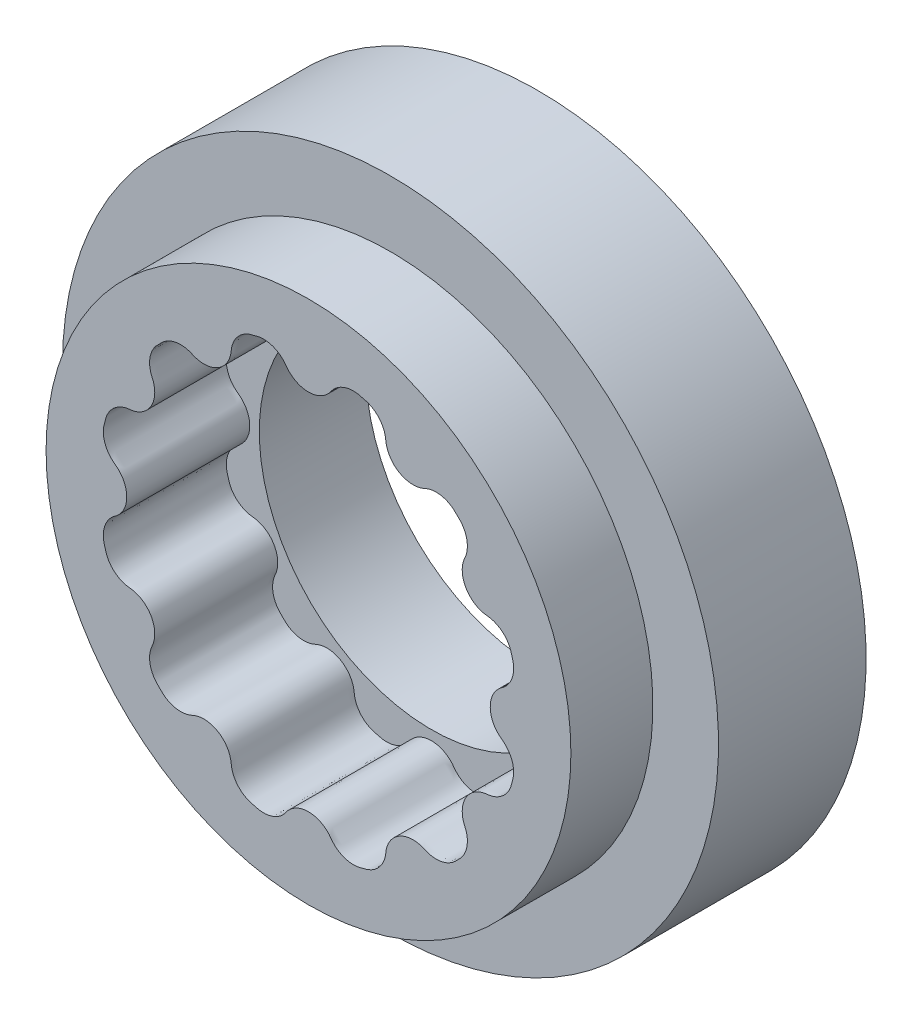
from build123d import *

# Parameters (mm, degrees)
SKETCH1_R           = 32
BOSS_EXTRUDE1_DEPTH = 15
SKETCH3_R           = 40
SKETCH3_R_2         = 30
BOSS_EXTRUDE3_DEPTH = 5
BOSS_EXTRUDE4_START = 13
SKETCH4_R           = 40
SKETCH4_R_2         = 21
BOSS_EXTRUDE4_DEPTH = 13
SKETCH5_R           = 1.5
CUT_EXTRUDE1_DEPTH  = 15
SKETCH6_R           = 2.5
CUT_EXTRUDE2_DEPTH  = 3


with BuildPart() as part:
    # Sketch1 → Boss-Extrude1 (new body)
    with BuildSketch(Plane.XY):
        Circle(SKETCH1_R)
        with BuildLine():
            add(Edge.make_bspline(
                [(7.008727405, -24.725851657), (8.387650315, -24.334985655), (9.300444766, -23.229992029), (9.423952389, -21.802073792), (9.424010864, -21.801397737), (9.424127402, -21.800045592), (9.424300875, -21.79801726), (9.42441742, -21.796665116), (9.424475899, -21.795989061), (9.64427829, -19.254928914), (11.853118443, -17.979654457), (14.163642278, -19.059830077), (14.164256998, -19.06011746), (14.165486262, -19.060692601), (14.167329586, -19.061556535), (14.168558847, -19.062131682), (14.169173565, -19.062419069), (15.452230516, -19.662259733), (16.850366203, -19.435851779), (17.878544188, -18.46173988), (17.885306871, -18.455332808), (17.898778593, -18.442462044), (17.918818206, -18.422980608), (17.93216718, -18.409982809), (17.938838132, -18.403480282), (18.095694749, -18.250583904), (18.250583904, -18.095694749), (18.403480282, -17.938838132), (18.409982809, -17.93216718), (18.422980608, -17.918818206), (18.442462044, -17.898778593), (18.455332808, -17.885306871), (18.46173988, -17.878544188), (19.435851779, -16.850366203), (19.662259733, -15.452230516), (19.062419069, -14.169173565), (19.062131682, -14.168558847), (19.061556535, -14.167329586), (19.060692601, -14.165486262), (19.06011746, -14.164256998), (19.059830077, -14.163642278), (17.979654457, -11.853118443), (19.254928914, -9.64427829), (21.795989061, -9.424475899), (21.796665116, -9.42441742), (21.79801726, -9.424300875), (21.800045592, -9.424127402), (21.801397737, -9.424010864), (21.802073792, -9.423952389), (23.213154038, -9.301901166), (24.310771085, -8.406758284), (24.71414339, -7.04906364), (24.716796509, -7.040133612), (24.72202798, -7.022251341), (24.729642076, -6.995360117), (24.734703727, -6.977429206), (24.737229677, -6.968462376), (24.796623304, -6.75762192), (24.85331667, -6.5460394), (24.907300508, -6.333749395), (24.909596386, -6.324720918), (24.914178322, -6.306661468), (24.921029935, -6.279565937), (24.925440483, -6.261463701), (24.927607828, -6.25240351), (25.257124487, -4.874919305), (24.754131682, -3.550894306), (23.593125953, -2.739654723), (23.59256971, -2.739266055), (23.591456988, -2.738489058), (23.589787137, -2.73732466), (23.588674418, -2.736547656), (23.588118177, -2.736158985), (21.497396733, -1.275274457), (21.497396733, 1.275274457), (23.588118177, 2.736158985), (23.588674418, 2.736547656), (23.589787137, 2.73732466), (23.591456988, 2.738489058), (23.59256971, 2.739266055), (23.593125953, 2.739654723), (24.754131682, 3.550894306), (25.257124487, 4.874919305), (24.927607828, 6.25240351), (24.925440483, 6.261463701), (24.921029935, 6.279565937), (24.914178322, 6.306661468), (24.909596386, 6.324720918), (24.907300508, 6.333749395), (24.85331667, 6.5460394), (24.796623304, 6.75762192), (24.737229677, 6.968462376), (24.734703727, 6.977429206), (24.729642076, 6.995360117), (24.72202798, 7.022251341), (24.716796509, 7.040133612), (24.71414339, 7.04906364), (24.310771085, 8.406758284), (23.213154038, 9.301901166), (21.802073792, 9.423952389), (21.801397737, 9.424010864), (21.800045592, 9.424127402), (21.79801726, 9.424300875), (21.796665116, 9.42441742), (21.795989061, 9.424475899), (19.254928914, 9.64427829), (17.979654457, 11.853118443), (19.059830077, 14.163642278), (19.06011746, 14.164256998), (19.060692601, 14.165486262), (19.061556535, 14.167329586), (19.062131682, 14.168558847), (19.062419069, 14.169173565), (19.662259733, 15.452230516), (19.435851779, 16.850366203), (18.46173988, 17.878544188), (18.455332808, 17.885306871), (18.442462044, 17.898778593), (18.422980608, 17.918818206), (18.409982809, 17.93216718), (18.403480282, 17.938838132), (18.250583904, 18.095694749), (18.095694749, 18.250583904), (17.938838132, 18.403480282), (17.93216718, 18.409982809), (17.918818206, 18.422980608), (17.898778593, 18.442462044), (17.885306871, 18.455332808), (17.878544188, 18.46173988), (16.850366203, 19.435851779), (15.452230516, 19.662259733), (14.169173565, 19.062419069), (14.168558847, 19.062131682), (14.167329586, 19.061556535), (14.165486262, 19.060692601), (14.164256998, 19.06011746), (14.163642278, 19.059830077), (11.853118443, 17.979654457), (9.64427829, 19.254928914), (9.424475899, 21.795989061), (9.42441742, 21.796665116), (9.424300875, 21.79801726), (9.424127402, 21.800045592), (9.424010864, 21.801397737), (9.423952389, 21.802073792), (9.301901166, 23.213154038), (8.406758284, 24.310771085), (7.04906364, 24.71414339), (7.040133612, 24.716796509), (7.022251341, 24.72202798), (6.995360117, 24.729642076), (6.977429206, 24.734703727), (6.968462376, 24.737229677), (6.75762192, 24.796623304), (6.5460394, 24.85331667), (6.333749395, 24.907300508), (6.324720918, 24.909596386), (6.306661468, 24.914178322), (6.279565937, 24.921029935), (6.261463701, 24.925440483), (6.25240351, 24.927607828), (4.874919305, 25.257124487), (3.550894306, 24.754131682), (2.739654723, 23.593125953), (2.739266055, 23.59256971), (2.738489058, 23.591456988), (2.73732466, 23.589787137), (2.736547656, 23.588674418), (2.736158985, 23.588118177), (1.275274457, 21.497396733), (-1.275274457, 21.497396733), (-2.736158985, 23.588118177), (-2.736547656, 23.588674418), (-2.73732466, 23.589787137), (-2.738489058, 23.591456988), (-2.739266055, 23.59256971), (-2.739654723, 23.593125953), (-3.550894306, 24.754131682), (-4.874919305, 25.257124487), (-6.25240351, 24.927607828), (-6.261463701, 24.925440483), (-6.279565937, 24.921029935), (-6.306661468, 24.914178322), (-6.324720918, 24.909596386), (-6.333749395, 24.907300508), (-6.5460394, 24.85331667), (-6.75762192, 24.796623304), (-6.968462376, 24.737229677), (-6.977429206, 24.734703727), (-6.995360117, 24.729642076), (-7.022251341, 24.72202798), (-7.040133612, 24.716796509), (-7.04906364, 24.71414339), (-8.406758284, 24.310771085), (-9.301901166, 23.213154038), (-9.423952389, 21.802073792), (-9.424010864, 21.801397737), (-9.424127402, 21.800045592), (-9.424300875, 21.79801726), (-9.42441742, 21.796665116), (-9.424475899, 21.795989061), (-9.64427829, 19.254928914), (-11.853118443, 17.979654457), (-14.163642278, 19.059830077), (-14.164256998, 19.06011746), (-14.165486262, 19.060692601), (-14.167329586, 19.061556535), (-14.168558847, 19.062131682), (-14.169173565, 19.062419069), (-15.452230516, 19.662259733), (-16.850366203, 19.435851779), (-17.878544188, 18.46173988), (-17.885306871, 18.455332808), (-17.898778593, 18.442462044), (-17.918818206, 18.422980608), (-17.93216718, 18.409982809), (-17.938838132, 18.403480282), (-18.095694749, 18.250583904), (-18.250583904, 18.095694749), (-18.403480282, 17.938838132), (-18.409982809, 17.93216718), (-18.422980608, 17.918818206), (-18.442462044, 17.898778593), (-18.455332808, 17.885306871), (-18.46173988, 17.878544188), (-19.435851779, 16.850366203), (-19.662259733, 15.452230516), (-19.062419069, 14.169173565), (-19.062131682, 14.168558847), (-19.061556535, 14.167329586), (-19.060692601, 14.165486262), (-19.06011746, 14.164256998), (-19.059830077, 14.163642278), (-17.979654457, 11.853118443), (-19.254928914, 9.64427829), (-21.795989061, 9.424475899), (-21.796665116, 9.42441742), (-21.79801726, 9.424300875), (-21.800045592, 9.424127402), (-21.801397737, 9.424010864), (-21.802073792, 9.423952389), (-23.213154038, 9.301901166), (-24.310771085, 8.406758284), (-24.71414339, 7.04906364), (-24.716796509, 7.040133612), (-24.72202798, 7.022251341), (-24.729642076, 6.995360117), (-24.734703727, 6.977429206), (-24.737229677, 6.968462376), (-24.796623304, 6.75762192), (-24.85331667, 6.5460394), (-24.907300508, 6.333749395), (-24.909596386, 6.324720918), (-24.914178322, 6.306661468), (-24.921029935, 6.279565937), (-24.925440483, 6.261463701), (-24.927607828, 6.25240351), (-25.257124487, 4.874919305), (-24.754131682, 3.550894306), (-23.593125953, 2.739654723), (-23.59256971, 2.739266055), (-23.591456988, 2.738489058), (-23.589787137, 2.73732466), (-23.588674418, 2.736547656), (-23.588118177, 2.736158985), (-21.497396733, 1.275274457), (-21.497396733, -1.275274457), (-23.588118177, -2.736158985), (-23.588674418, -2.736547656), (-23.589787137, -2.73732466), (-23.591456988, -2.738489058), (-23.59256971, -2.739266055), (-23.593125953, -2.739654723), (-24.754131682, -3.550894306), (-25.257124487, -4.874919305), (-24.927607828, -6.25240351), (-24.925440483, -6.261463701), (-24.921029935, -6.279565937), (-24.914178322, -6.306661468), (-24.909596386, -6.324720918), (-24.907300508, -6.333749395), (-24.85331667, -6.5460394), (-24.796623304, -6.75762192), (-24.737229677, -6.968462376), (-24.734703727, -6.977429206), (-24.729642076, -6.995360117), (-24.72202798, -7.022251341), (-24.716796509, -7.040133612), (-24.71414339, -7.04906364), (-24.310771085, -8.406758284), (-23.213154038, -9.301901166), (-21.802073792, -9.423952389), (-21.801397737, -9.424010864), (-21.800045592, -9.424127402), (-21.79801726, -9.424300875), (-21.796665116, -9.42441742), (-21.795989061, -9.424475899), (-19.254928914, -9.64427829), (-17.979654457, -11.853118443), (-19.059830077, -14.163642278), (-19.06011746, -14.164256998), (-19.060692601, -14.165486262), (-19.061556535, -14.167329586), (-19.062131682, -14.168558847), (-19.062419069, -14.169173565), (-19.662259733, -15.452230516), (-19.435851779, -16.850366203), (-18.46173988, -17.878544188), (-18.455332808, -17.885306871), (-18.442462044, -17.898778593), (-18.422980608, -17.918818206), (-18.409982809, -17.93216718), (-18.403480282, -17.938838132), (-18.250583904, -18.095694749), (-18.095694749, -18.250583904), (-17.938838132, -18.403480282), (-17.93216718, -18.409982809), (-17.918818206, -18.422980608), (-17.898778593, -18.442462044), (-17.885306871, -18.455332808), (-17.878544188, -18.46173988), (-16.850366203, -19.435851779), (-15.452230516, -19.662259733), (-14.169173565, -19.062419069), (-14.168558847, -19.062131682), (-14.167329586, -19.061556535), (-14.165486262, -19.060692601), (-14.164256998, -19.06011746), (-14.163642278, -19.059830077), (-11.853118443, -17.979654457), (-9.64427829, -19.254928914), (-9.424475899, -21.795989061), (-9.42441742, -21.796665116), (-9.424300875, -21.79801726), (-9.424127402, -21.800045592), (-9.424010864, -21.801397737), (-9.423952389, -21.802073792), (-9.301901166, -23.213154038), (-8.406758284, -24.310771085), (-7.04906364, -24.71414339), (-7.040133612, -24.716796509), (-7.022251341, -24.72202798), (-6.995360117, -24.729642076), (-6.977429206, -24.734703727), (-6.968462376, -24.737229677), (-6.75762192, -24.796623304), (-6.5460394, -24.85331667), (-6.333749395, -24.907300508), (-6.324720918, -24.909596386), (-6.306661468, -24.914178322), (-6.279565937, -24.921029935), (-6.261463701, -24.925440483), (-6.25240351, -24.927607828), (-4.874919305, -25.257124487), (-3.550894306, -24.754131682), (-2.739654723, -23.593125953), (-2.739266055, -23.59256971), (-2.738489058, -23.591456988), (-2.73732466, -23.589787137), (-2.736547656, -23.588674418), (-2.736158985, -23.588118177), (-1.275274457, -21.497396733), (1.275274457, -21.497396733), (2.736158985, -23.588118177), (2.736547656, -23.588674418), (2.73732466, -23.589787137), (2.738489058, -23.591456988), (2.739266055, -23.59256971), (2.739654723, -23.593125953), (3.56057458, -24.76798561), (4.903574577, -25.268540935), (6.293189848, -24.917579368), (6.372992785, -24.897424319), (6.531107676, -24.851210749), (6.769500213, -24.787333662), (6.92953851, -24.748298341), (7.008727405, -24.725851657)],
                knots=[0, 0, 0, 0, 0.022861669, 0.022861669, 0.022861669, 0.022873941, 0.022886214, 0.022898486, 0.022898486, 0.022898486, 0.055887763, 0.055887763, 0.055887763, 0.055900036, 0.055912308, 0.05592458, 0.05592458, 0.05592458, 0.078577418, 0.078577418, 0.078577418, 0.078745896, 0.078914374, 0.079082852, 0.079082852, 0.079082852, 0.083044128, 0.083044128, 0.083044128, 0.083212606, 0.083381085, 0.083549563, 0.083549563, 0.083549563, 0.1062024, 0.1062024, 0.1062024, 0.106214673, 0.106226945, 0.106239217, 0.106239217, 0.106239217, 0.139228495, 0.139228495, 0.139228495, 0.139240767, 0.139253039, 0.139265311, 0.139265311, 0.139265311, 0.161918149, 0.161918149, 0.161918149, 0.162086627, 0.162255106, 0.162423584, 0.162423584, 0.162423584, 0.16638486, 0.16638486, 0.16638486, 0.166553338, 0.166721816, 0.166890294, 0.166890294, 0.166890294, 0.189543132, 0.189543132, 0.189543132, 0.189555404, 0.189567676, 0.189579948, 0.189579948, 0.189579948, 0.222569226, 0.222569226, 0.222569226, 0.222581498, 0.222593771, 0.222606043, 0.222606043, 0.222606043, 0.24525888, 0.24525888, 0.24525888, 0.245427359, 0.245595837, 0.245764315, 0.245764315, 0.245764315, 0.249725591, 0.249725591, 0.249725591, 0.249894069, 0.250062547, 0.250231025, 0.250231025, 0.250231025, 0.272883863, 0.272883863, 0.272883863, 0.272896135, 0.272908408, 0.27292068, 0.27292068, 0.27292068, 0.305909957, 0.305909957, 0.305909957, 0.30592223, 0.305934502, 0.305946774, 0.305946774, 0.305946774, 0.328599612, 0.328599612, 0.328599612, 0.32876809, 0.328936568, 0.329105046, 0.329105046, 0.329105046, 0.333066322, 0.333066322, 0.333066322, 0.3332348, 0.333403279, 0.333571757, 0.333571757, 0.333571757, 0.356224594, 0.356224594, 0.356224594, 0.356236867, 0.356249139, 0.356261411, 0.356261411, 0.356261411, 0.389250689, 0.389250689, 0.389250689, 0.389262961, 0.389275233, 0.389287505, 0.389287505, 0.389287505, 0.411940343, 0.411940343, 0.411940343, 0.412108821, 0.4122773, 0.412445778, 0.412445778, 0.412445778, 0.416407054, 0.416407054, 0.416407054, 0.416575532, 0.41674401, 0.416912488, 0.416912488, 0.416912488, 0.439565326, 0.439565326, 0.439565326, 0.439577598, 0.43958987, 0.439602142, 0.439602142, 0.439602142, 0.47259142, 0.47259142, 0.47259142, 0.472603692, 0.472615965, 0.472628237, 0.472628237, 0.472628237, 0.495281074, 0.495281074, 0.495281074, 0.495449553, 0.495618031, 0.495786509, 0.495786509, 0.495786509, 0.499747785, 0.499747785, 0.499747785, 0.499916263, 0.500084741, 0.500253219, 0.500253219, 0.500253219, 0.522906057, 0.522906057, 0.522906057, 0.522918329, 0.522930602, 0.522942874, 0.522942874, 0.522942874, 0.555932151, 0.555932151, 0.555932151, 0.555944424, 0.555956696, 0.555968968, 0.555968968, 0.555968968, 0.578621806, 0.578621806, 0.578621806, 0.578790284, 0.578958762, 0.57912724, 0.57912724, 0.57912724, 0.583088516, 0.583088516, 0.583088516, 0.583256994, 0.583425473, 0.583593951, 0.583593951, 0.583593951, 0.606246788, 0.606246788, 0.606246788, 0.606259061, 0.606271333, 0.606283605, 0.606283605, 0.606283605, 0.639272883, 0.639272883, 0.639272883, 0.639285155, 0.639297427, 0.639309699, 0.639309699, 0.639309699, 0.661962537, 0.661962537, 0.661962537, 0.662131015, 0.662299493, 0.662467972, 0.662467972, 0.662467972, 0.666429248, 0.666429248, 0.666429248, 0.666597726, 0.666766204, 0.666934682, 0.666934682, 0.666934682, 0.68958752, 0.68958752, 0.68958752, 0.689599792, 0.689612064, 0.689624336, 0.689624336, 0.689624336, 0.722613614, 0.722613614, 0.722613614, 0.722625886, 0.722638159, 0.722650431, 0.722650431, 0.722650431, 0.745303268, 0.745303268, 0.745303268, 0.745471747, 0.745640225, 0.745808703, 0.745808703, 0.745808703, 0.749769979, 0.749769979, 0.749769979, 0.749938457, 0.750106935, 0.750275413, 0.750275413, 0.750275413, 0.772928251, 0.772928251, 0.772928251, 0.772940523, 0.772952796, 0.772965068, 0.772965068, 0.772965068, 0.805954345, 0.805954345, 0.805954345, 0.805966618, 0.80597889, 0.805991162, 0.805991162, 0.805991162, 0.828644, 0.828644, 0.828644, 0.828812478, 0.828980956, 0.829149434, 0.829149434, 0.829149434, 0.83311071, 0.83311071, 0.83311071, 0.833279188, 0.833447667, 0.833616145, 0.833616145, 0.833616145, 0.856268982, 0.856268982, 0.856268982, 0.856281255, 0.856293527, 0.856305799, 0.856305799, 0.856305799, 0.889295077, 0.889295077, 0.889295077, 0.889307349, 0.889319621, 0.889331893, 0.889331893, 0.889331893, 0.911984731, 0.911984731, 0.911984731, 0.912153209, 0.912321687, 0.912490166, 0.912490166, 0.912490166, 0.916451442, 0.916451442, 0.916451442, 0.91661992, 0.916788398, 0.916956876, 0.916956876, 0.916956876, 0.939609714, 0.939609714, 0.939609714, 0.939621986, 0.939634258, 0.93964653, 0.93964653, 0.93964653, 0.972635808, 0.972635808, 0.972635808, 0.97264808, 0.972660353, 0.972672625, 0.972672625, 0.972672625, 0.995534294, 0.995534294, 0.995534294, 0.997022863, 0.998511431, 1, 1, 1, 1], degree=3, weights=[1, 0.881989361, 0.881989361, 1, 1, 1, 1, 1, 1, 0.715181732, 0.715181732, 1, 1, 1, 1, 1, 1, 0.884361143, 0.884361143, 1, 1, 1, 1, 1, 1, 0.99994552, 0.99994552, 1, 1, 1, 1, 1, 1, 0.884361143, 0.884361143, 1, 1, 1, 1, 1, 1, 0.715181732, 0.715181732, 1, 1, 1, 1, 1, 1, 0.884361143, 0.884361143, 1, 1, 1, 1, 1, 1, 0.99994552, 0.99994552, 1, 1, 1, 1, 1, 1, 0.884361143, 0.884361143, 1, 1, 1, 1, 1, 1, 0.715181732, 0.715181732, 1, 1, 1, 1, 1, 1, 0.884361143, 0.884361143, 1, 1, 1, 1, 1, 1, 0.99994552, 0.99994552, 1, 1, 1, 1, 1, 1, 0.884361143, 0.884361143, 1, 1, 1, 1, 1, 1, 0.715181732, 0.715181732, 1, 1, 1, 1, 1, 1, 0.884361143, 0.884361143, 1, 1, 1, 1, 1, 1, 0.99994552, 0.99994552, 1, 1, 1, 1, 1, 1, 0.884361143, 0.884361143, 1, 1, 1, 1, 1, 1, 0.715181732, 0.715181732, 1, 1, 1, 1, 1, 1, 0.884361143, 0.884361143, 1, 1, 1, 1, 1, 1, 0.99994552, 0.99994552, 1, 1, 1, 1, 1, 1, 0.884361143, 0.884361143, 1, 1, 1, 1, 1, 1, 0.715181732, 0.715181732, 1, 1, 1, 1, 1, 1, 0.884361143, 0.884361143, 1, 1, 1, 1, 1, 1, 0.99994552, 0.99994552, 1, 1, 1, 1, 1, 1, 0.884361143, 0.884361143, 1, 1, 1, 1, 1, 1, 0.715181732, 0.715181732, 1, 1, 1, 1, 1, 1, 0.884361143, 0.884361143, 1, 1, 1, 1, 1, 1, 0.99994552, 0.99994552, 1, 1, 1, 1, 1, 1, 0.884361143, 0.884361143, 1, 1, 1, 1, 1, 1, 0.715181732, 0.715181732, 1, 1, 1, 1, 1, 1, 0.884361143, 0.884361143, 1, 1, 1, 1, 1, 1, 0.99994552, 0.99994552, 1, 1, 1, 1, 1, 1, 0.884361143, 0.884361143, 1, 1, 1, 1, 1, 1, 0.715181732, 0.715181732, 1, 1, 1, 1, 1, 1, 0.884361143, 0.884361143, 1, 1, 1, 1, 1, 1, 0.99994552, 0.99994552, 1, 1, 1, 1, 1, 1, 0.884361143, 0.884361143, 1, 1, 1, 1, 1, 1, 0.715181732, 0.715181732, 1, 1, 1, 1, 1, 1, 0.884361143, 0.884361143, 1, 1, 1, 1, 1, 1, 0.99994552, 0.99994552, 1, 1, 1, 1, 1, 1, 0.884361143, 0.884361143, 1, 1, 1, 1, 1, 1, 0.715181732, 0.715181732, 1, 1, 1, 1, 1, 1, 0.884361143, 0.884361143, 1, 1, 1, 1, 1, 1, 0.99994552, 0.99994552, 1, 1, 1, 1, 1, 1, 0.884361143, 0.884361143, 1, 1, 1, 1, 1, 1, 0.715181732, 0.715181732, 1, 1, 1, 1, 1, 1, 0.881989361, 0.881989361, 1, 1, 1, 1, 1, 1]))
        make_face(mode=Mode.SUBTRACT)
    extrude(amount=BOSS_EXTRUDE1_DEPTH)

    # Sketch3 → Boss-Extrude3 (add)
    with BuildSketch(Plane(origin=(0, 0, 0), x_dir=(-1, 0, 0), z_dir=(0, 0, -1))):
        Circle(SKETCH3_R)
        Circle(SKETCH3_R_2, mode=Mode.SUBTRACT)
    extrude(amount=-BOSS_EXTRUDE3_DEPTH)

    # Sketch4 → Boss-Extrude4 (add)
    with BuildSketch(Plane(origin=(0, 0, 0), x_dir=(-1, 0, 0), z_dir=(0, 0, -1)).offset(BOSS_EXTRUDE4_START)):
        Circle(SKETCH4_R)
        Circle(SKETCH4_R_2, mode=Mode.SUBTRACT)
    extrude(amount=-BOSS_EXTRUDE4_DEPTH)

    # Sketch5 → Cut-Extrude1 (cut)
    with BuildSketch(Plane(origin=(0, 0, -13), x_dir=(-1, 0, 0), z_dir=(0, 0, -1))):
        with Locations((0, 35)):
            Circle(SKETCH5_R)
        with Locations((24.748737342, 24.748737342)):
            Circle(SKETCH5_R)
        with Locations((35, 0)):
            Circle(SKETCH5_R)
        with Locations((24.748737342, -24.748737342)):
            Circle(SKETCH5_R)
        with Locations((0, -35)):
            Circle(SKETCH5_R)
        with Locations((-24.748737342, -24.748737342)):
            Circle(SKETCH5_R)
        with Locations((-35, 0)):
            Circle(SKETCH5_R)
        with Locations((-24.748737342, 24.748737342)):
            Circle(SKETCH5_R)
    extrude(amount=-CUT_EXTRUDE1_DEPTH, mode=Mode.SUBTRACT)

    # Sketch6 → Cut-Extrude2 (cut)
    with BuildSketch(Plane(origin=(0, 0, -13), x_dir=(-1, 0, 0), z_dir=(0, 0, -1))):
        with Locations((0, 35)):
            Circle(SKETCH6_R)
        with Locations((35, 0)):
            Circle(SKETCH6_R)
        with Locations((0, -35)):
            Circle(SKETCH6_R)
        with Locations((-35, 0)):
            Circle(SKETCH6_R)
    extrude(amount=-CUT_EXTRUDE2_DEPTH, mode=Mode.SUBTRACT)


solid = part.part
